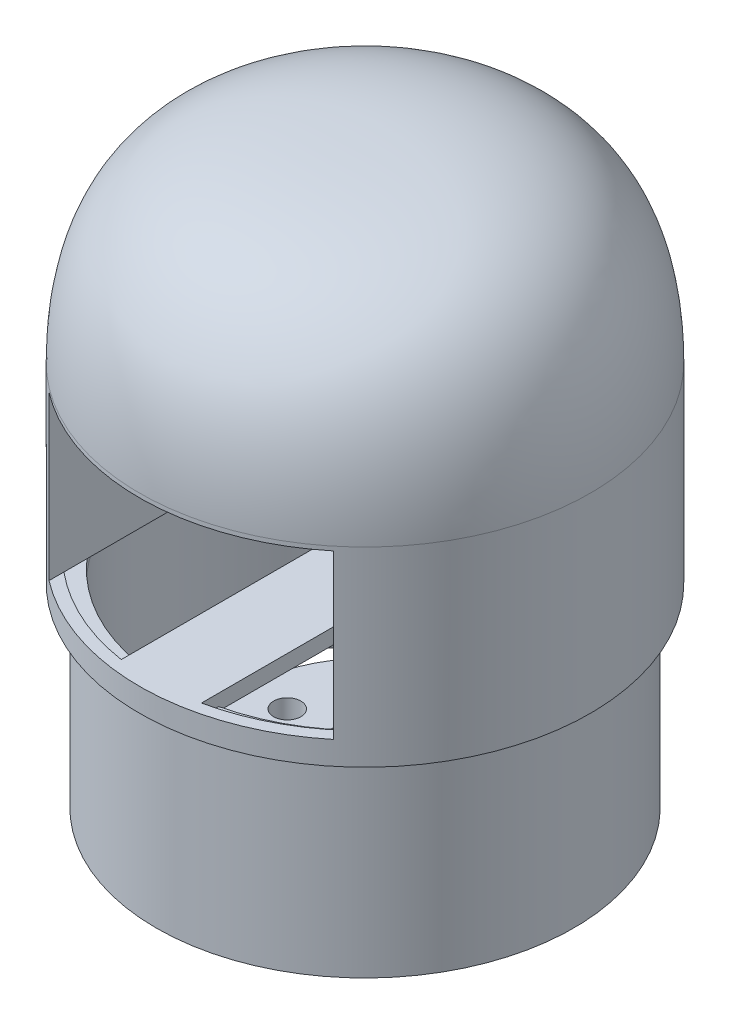
from build123d import *

# Parameters (mm, degrees)
SKETCH1_R                       = 26.85
SKETCH1_R_2                     = 25.35
BOSS_EXTRUDE3_DEPTH             = 25
SKETCH3_R                       = 1.75
SKETCH3_R_2                     = 5
BOSS_EXTRUDE4_DEPTH             = 6
CUT_EXTRUDE1_DEPTH              = 86.480992195
CUT_EXTRUDE1_DEPTH_BACK         = 86.480992195
SKETCH5_W                       = 36
SKETCH5_H                       = 21
BOSS_EXTRUDE6_REACH             = 87.481
SKETCH6_W                       = 2
SKETCH6_H                       = 21
SKETCH6_W_2                     = 10
SKETCH6_H_2                     = 2
BOSS_EXTRUDE6_DIRECTION_2_REACH = 87.481


with BuildPart() as part:
    # Sketch1 → Boss-Extrude3 (new body)
    with BuildSketch(Plane(origin=(0, 0, 0), x_dir=(1, 0, 0), z_dir=(0, 1, 0))):
        Circle(SKETCH1_R)
        Circle(SKETCH1_R_2, mode=Mode.SUBTRACT)
    extrude(amount=BOSS_EXTRUDE3_DEPTH)

    # Sketch3 → Boss-Extrude4 (add)
    with BuildSketch(Plane.XZ):
        with BuildLine():
            Line((-25.032428967, 4), (-14.456832295, 4))
            ThreePointArc((-14.456832295, 4), (-10.606601718, 10.606601718), (-4, 14.456832295))
            Line((-4, 14.456832295), (-4, 25.032428967))
            ThreePointArc((-4, 25.032428967), (0, 25.35), (4, 25.032428967))
            Line((4, 25.032428967), (4, 14.456832295))
            ThreePointArc((4, 14.456832295), (10.606601718, 10.606601718), (14.456832295, 4))
            Line((14.456832295, 4), (25.032428967, 4))
            ThreePointArc((25.032428967, 4), (25.35, 0), (25.032428967, -4))
            Line((25.032428967, -4), (14.456832295, -4))
            ThreePointArc((14.456832295, -4), (10.606601718, -10.606601718), (4, -14.456832295))
            Line((4, -14.456832295), (4, -25.032428967))
            ThreePointArc((4, -25.032428967), (0, -25.35), (-4, -25.032428967))
            Line((-4, -25.032428967), (-4, -14.456832295))
            ThreePointArc((-4, -14.456832295), (-10.606601718, -10.606601718), (-14.456832295, -4))
            Line((-14.456832295, -4), (-25.032428967, -4))
            ThreePointArc((-25.032428967, -4), (-25.35, 0), (-25.032428967, 4))
        make_face()
        with Locations((-10, 0)):
            Circle(SKETCH3_R, mode=Mode.SUBTRACT)
        with Locations((0, 10)):
            Circle(SKETCH3_R, mode=Mode.SUBTRACT)
        with Locations((10, 0)):
            Circle(SKETCH3_R, mode=Mode.SUBTRACT)
        with Locations((0, -10)):
            Circle(SKETCH3_R, mode=Mode.SUBTRACT)
        Circle(SKETCH3_R_2, mode=Mode.SUBTRACT)
    extrude(amount=-BOSS_EXTRUDE4_DEPTH)

    # Sketch4 → Revolve1 (revolve)
    with BuildSketch(Plane.XY):
        with BuildLine():
            Line((-29, 25), (-26.85, 25))
            Line((-26.85, 25), (-25.337068778, 25))
            Line((-25.337068778, 25), (-25.337068778, 26.5))
            Line((-25.337068778, 26.5), (-26.85, 26.5))
            Line((-26.85, 26.5), (-27.5, 26.5))
            Line((-27.5, 26.5), (-27.5, 49.530489624))
            add(Edge.make_bspline(
                [(-27.5, 49.530489624), (-27.5, 50.197264571), (-27.472521365, 51.558922743), (-27.311990262, 54.054064078), (-26.921684879, 56.911244037), (-26.177462562, 59.897205908), (-25.185107558, 62.48367016), (-23.970018329, 64.701810454), (-22.079491429, 67.219839689), (-19.242715048, 69.641387186), (-15.144651578, 71.621760411), (-10.455815959, 72.828150388), (-5.361428577, 73.411616634), (-1.771873481, 73.5), (0, 73.5)],
                knots=[0, 0, 0, 0, 0.03125, 0.0625, 0.125, 0.1875, 0.25, 0.3125, 0.375, 0.5, 0.625, 0.75, 0.875, 1, 1, 1, 1], degree=3))
            Line((0, 73.5), (0, 75))
            add(Edge.make_bspline(
                [(-29, 49.530489624), (-29, 72.140221292), (-14.522512801, 75), (0, 75)],
                knots=[0, 0, 0, 0, 1, 1, 1, 1], degree=3))
            Line((-29, 49.530489624), (-29, 25))
        make_face()
    revolve(axis=Axis((0, 0, 0), (0, 1, 0)))

    # Sketch5 → Cut-Extrude1 (cut, two sides: drawn at the far end of the back side and taken through both)
    with BuildSketch(Plane.XY.offset(-CUT_EXTRUDE1_DEPTH_BACK)):
        with Locations((0.3887064, 38.5)):
            Rectangle(SKETCH5_W, SKETCH5_H)
    extrude(amount=CUT_EXTRUDE1_DEPTH + CUT_EXTRUDE1_DEPTH_BACK, mode=Mode.SUBTRACT)

    # Sketch6 → Boss-Extrude6 (add, up to next)
    with BuildSketch(Plane.XY, mode=Mode.PRIVATE) as boss_extrude6_sk1:
        with Locations((-18.6112936, 38.5)):
            Rectangle(SKETCH6_W, SKETCH6_H)
    boss_extrude6_tool1 = extrude(boss_extrude6_sk1.sketch, amount=-BOSS_EXTRUDE6_REACH, mode=Mode.PRIVATE) - part.part
    # Sketch6 → Boss-Extrude6 (add, up to next)
    with BuildSketch(Plane.XY, mode=Mode.PRIVATE) as boss_extrude6_sk2:
        with Locations((0.830023886, 27)):
            Rectangle(SKETCH6_W_2, SKETCH6_H_2)
    boss_extrude6_tool2 = extrude(boss_extrude6_sk2.sketch, amount=-BOSS_EXTRUDE6_REACH, mode=Mode.PRIVATE) - part.part
    # Sketch6 → Boss-Extrude6 (add, up to next)
    with BuildSketch(Plane.XY, mode=Mode.PRIVATE) as boss_extrude6_sk3:
        with Locations((0.830023886, 50)):
            Rectangle(SKETCH6_W_2, SKETCH6_H_2)
    boss_extrude6_tool3 = extrude(boss_extrude6_sk3.sketch, amount=-BOSS_EXTRUDE6_REACH, mode=Mode.PRIVATE) - part.part
    add(boss_extrude6_tool1.solids().sort_by_distance((-18.611294, 38.5, 0))[0])
    add(boss_extrude6_tool2.solids().sort_by_distance((0.830024, 27, 0))[0])
    add(boss_extrude6_tool3.solids().sort_by_distance((0.830024, 50, 0))[0])

    # Sketch6 → Boss-Extrude6 direction 2 (add, up to next)
    with BuildSketch(Plane.XY, mode=Mode.PRIVATE) as boss_extrude6_direction_2_sk1:
        with Locations((-18.6112936, 38.5)):
            Rectangle(SKETCH6_W, SKETCH6_H)
    boss_extrude6_direction_2_tool1 = extrude(boss_extrude6_direction_2_sk1.sketch, amount=BOSS_EXTRUDE6_DIRECTION_2_REACH, mode=Mode.PRIVATE) - part.part
    # Sketch6 → Boss-Extrude6 direction 2 (add, up to next)
    with BuildSketch(Plane.XY, mode=Mode.PRIVATE) as boss_extrude6_direction_2_sk2:
        with Locations((0.830023886, 27)):
            Rectangle(SKETCH6_W_2, SKETCH6_H_2)
    boss_extrude6_direction_2_tool2 = extrude(boss_extrude6_direction_2_sk2.sketch, amount=BOSS_EXTRUDE6_DIRECTION_2_REACH, mode=Mode.PRIVATE) - part.part
    # Sketch6 → Boss-Extrude6 direction 2 (add, up to next)
    with BuildSketch(Plane.XY, mode=Mode.PRIVATE) as boss_extrude6_direction_2_sk3:
        with Locations((0.830023886, 50)):
            Rectangle(SKETCH6_W_2, SKETCH6_H_2)
    boss_extrude6_direction_2_tool3 = extrude(boss_extrude6_direction_2_sk3.sketch, amount=BOSS_EXTRUDE6_DIRECTION_2_REACH, mode=Mode.PRIVATE) - part.part
    add(boss_extrude6_direction_2_tool1.solids().sort_by_distance((-18.611294, 38.5, 0))[0])
    add(boss_extrude6_direction_2_tool2.solids().sort_by_distance((0.830024, 27, 0))[0])
    add(boss_extrude6_direction_2_tool3.solids().sort_by_distance((0.830024, 50, 0))[0])


solid = part.part
